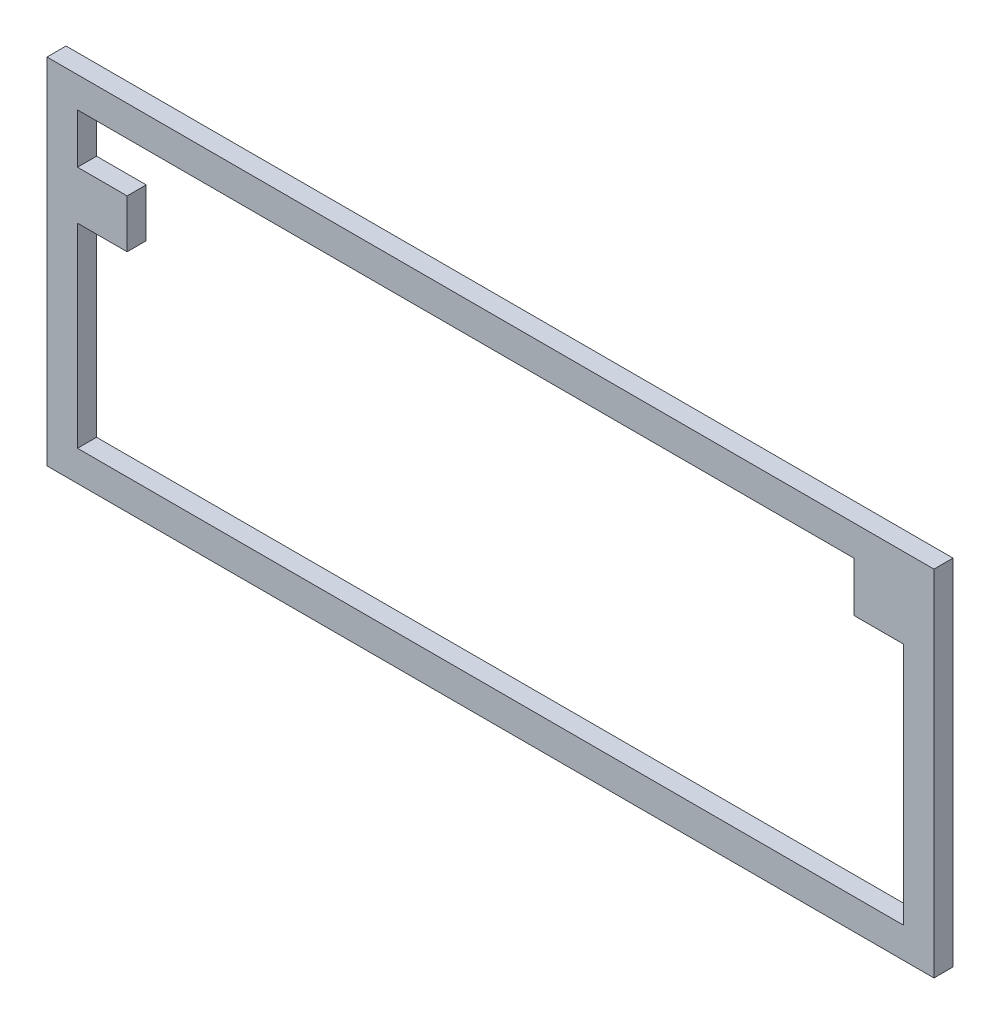
from build123d import *

# Parameters (mm, degrees)
SKETCH1_W           = 348.79935
SKETCH1_H           = 139.24936
BOSS_EXTRUDE1_DEPTH = 7.5


with BuildPart() as part:
    # Sketch1 → Boss-Extrude1 (new body)
    with BuildSketch(Plane.XY):
        with Locations((3.1751, -8e-05)):
            Rectangle(SKETCH1_W, SKETCH1_H)
        Polygon((-159.224575, -57.62476), (165.574775, -57.62476), (165.574775, 38.0997), (146.049775, 38.0997), (146.049775, 57.6246), (-159.224575, 57.6246), (-159.224575, 38.0997), (-139.699525, 38.0997), (-139.699525, 19.0504), (-159.224575, 19.0504), align=None, mode=Mode.SUBTRACT)
    extrude(amount=-BOSS_EXTRUDE1_DEPTH)


solid = part.part
